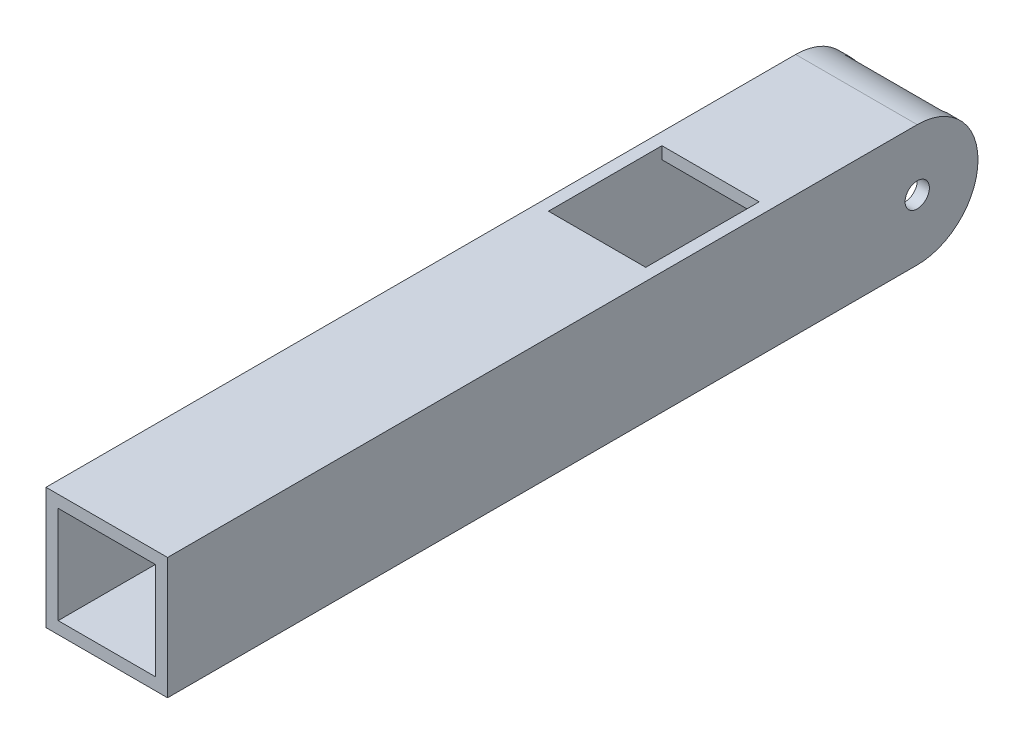
from build123d import *

# Parameters (mm, degrees)
ESQUISSE1_W             = 15
ESQUISSE1_H             = 15
EXTRUSION1_DEPTH        = 100
ESQUISSE2_W             = 12
ESQUISSE2_H             = 12
EXTRUSION2_DEPTH        = 101.560926806
CONG_1_R                = 7.5
ESQUISSE3_R             = 1.5
EXTRUSION3_DEPTH        = 102.396498953
ESQUISSE4_W             = 12
ESQUISSE4_H             = 14
ENL_V_MAT_EXTRU_1_DEPTH = 3


with BuildPart() as part:
    # Esquisse1 → Extrusion1 (new body)
    with BuildSketch(Plane.XY):
        Rectangle(ESQUISSE1_W, ESQUISSE1_H)
    extrude(amount=EXTRUSION1_DEPTH)

    # Esquisse2 → Extrusion2 (cut, through all)
    with BuildSketch(Plane.XY.offset(100)):
        Rectangle(ESQUISSE2_W, ESQUISSE2_H)
    extrude(amount=-EXTRUSION2_DEPTH, mode=Mode.SUBTRACT)

    # Congé1
    # the kernel refuses this fillet: 7.5 mm, written as the material it takes off along each edge
    with BuildSketch(Plane(origin=(-26.25, -7.5, 0), x_dir=(0, 0, 1), z_dir=(1, 0, 0))) as cong_1_piece_1:
        with BuildLine():
            CenterArc((CONG_1_R, -CONG_1_R), CONG_1_R, 90, 90)
            Line((0, -CONG_1_R), (0, 0))
            Line((0, 0), (CONG_1_R, 0))
        make_face()
    extrude(amount=52.5, mode=Mode.SUBTRACT)
    with BuildSketch(Plane(origin=(26.25, 7.5, 0), x_dir=(0, -1, 0), z_dir=(-1, 0, 0))) as cong_1_piece_2:
        with BuildLine():
            CenterArc((CONG_1_R, CONG_1_R), CONG_1_R, 180, 90)
            Line((0, CONG_1_R), (0, 0))
            Line((0, 0), (CONG_1_R, 0))
        make_face()
    extrude(amount=52.5, mode=Mode.SUBTRACT)

    # Esquisse3 → Extrusion3 (cut, through all)
    with BuildSketch(Plane(origin=(7.5, 0, 0), x_dir=(0, 0, -1), z_dir=(1, 0, 0))):
        with Locations((-7.5, 0)):
            Circle(ESQUISSE3_R)
    extrude(amount=-EXTRUSION3_DEPTH, mode=Mode.SUBTRACT)

    # Esquisse4 → Enlèv. mat.-Extru.1 (cut)
    with BuildSketch(Plane(origin=(0, 7.5, 0), x_dir=(-1, 0, 0), z_dir=(0, 1, 0))):
        with Locations((0, 32.5)):
            Rectangle(ESQUISSE4_W, ESQUISSE4_H)
    extrude(amount=-ENL_V_MAT_EXTRU_1_DEPTH, mode=Mode.SUBTRACT)


solid = part.part
